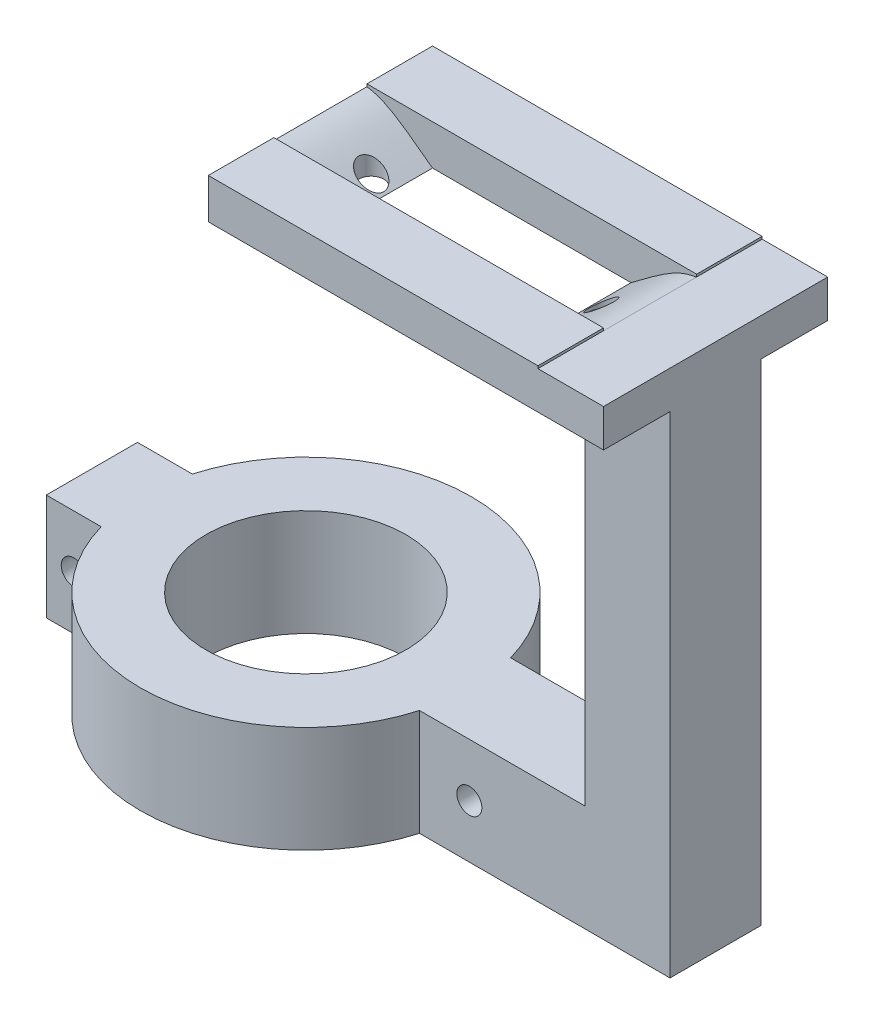
from build123d import *

# Parameters (mm, degrees)
SKETCH_1_W           = 50.28
SKETCH_1_H           = 34.2
SKETCH_1_W_2         = 30.28
SKETCH_1_H_2         = 14.2
EXTRUDE_1_DEPTH      = 12.25
SKETCH_4_W           = 13
SKETCH_4_H           = 13.91
EXTRUDE_1_2_DEPTH    = 74.82
SKETCH_5_W           = 13.91
SKETCH_5_H           = 16.23
EXTRUDE_2_DEPTH      = 16
SKETCH_7_R           = 25.25
SKETCH_7_R_2         = 15.25
EXTRUDE_2_2_DEPTH    = 16.23
SKETCH_15_R          = 1.91
CUT_EXTRUDE_6_DEPTH  = 97.964478439
SKETCH_16_W          = 13.91
SKETCH_16_H          = 16.23
EXTRUDE_4_DEPTH      = 10
SKETCH_17_R          = 1.91
CUT_EXTRUDE_7_DEPTH  = 102.16913771
SKETCH_18_W          = 49.344544624
SKETCH_18_H          = 6.125
CUT_EXTRUDE_8_DEPTH  = 105.840616652
SKETCH_19_W          = 34.2
SKETCH_19_H          = 6.125
CUT_EXTRUDE_9_DEPTH  = 10
SKETCH_21_R          = 1.91
CUT_EXTRUDE_10_DEPTH = 10
SKETCH_20_R          = 1.91
CUT_EXTRUDE_11_DEPTH = 10
FILLET_START         = -7.1
FILLET_1_DEPTH       = 14.2
FILLET_2_DEPTH       = 14.2
SKETCH_29_W          = 13.91
SKETCH_29_H          = 74.82
EXTRUDE_5_DEPTH      = 10
SKETCH_30_W          = 10
SKETCH_30_H          = 58.59
CUT_EXTRUDE_13_DEPTH = 102.16913771
SKETCH_32_W          = 34.2
SKETCH_32_H          = 5.745736365
EXTRUDE_6_DEPTH      = 10


with BuildPart() as part:
    # 草圖1 → Extrude 1 (new body)
    with BuildSketch(Plane(origin=(0, 0, 0), x_dir=(1, 0, 0), z_dir=(0, 1, 0))):
        Rectangle(SKETCH_1_W, SKETCH_1_H)
        Rectangle(SKETCH_1_W_2, SKETCH_1_H_2, mode=Mode.SUBTRACT)
    extrude(amount=EXTRUDE_1_DEPTH)

    # 草圖4 → Extrude 1 2 (add)
    with BuildSketch(Plane.XZ):
        with Locations((18.64, 0)):
            Rectangle(SKETCH_4_W, SKETCH_4_H)
    extrude(amount=EXTRUDE_1_2_DEPTH)

    # 草圖5 → Extrude 2 (add)
    with BuildSketch(Plane.ZY.offset(-12.14)):
        with Locations((0, -66.705)):
            Rectangle(SKETCH_5_W, SKETCH_5_H)
    extrude(amount=EXTRUDE_2_DEPTH)

    # 草圖7 → Extrude 2 2 (add)
    with BuildSketch(Plane(origin=(3.626674765, -74.82, 0), x_dir=(1, 0, 0), z_dir=(0, -1, 0))):
        with Locations((-30.978154344, 0)):
            Circle(SKETCH_7_R)
        with Locations((-30.978154344, 0)):
            Circle(SKETCH_7_R_2, mode=Mode.SUBTRACT)
    extrude(amount=-EXTRUDE_2_2_DEPTH)

    # 草圖15 → 除料-伸長6 (cut, through all)
    with BuildSketch(Plane(origin=(0, 0, -6.955), x_dir=(-1, 0, 0), z_dir=(0, 0, -1))):
        with Locations((-4.530883248, -66.705)):
            Circle(SKETCH_15_R)
    extrude(amount=-CUT_EXTRUDE_6_DEPTH, mode=Mode.SUBTRACT)

    # 草圖16 → 填料-伸長4 (add)
    with BuildSketch(Plane(origin=(-60, 0, 0), x_dir=(0, 0, -1), z_dir=(1, 0, 0))):
        with Locations((0, -66.705)):
            Rectangle(SKETCH_16_W, SKETCH_16_H)
    extrude(amount=EXTRUDE_4_DEPTH)

    # 草圖17 → 除料-伸長7 (cut, through all)
    with BuildSketch(Plane(origin=(0, 0, -6.955), x_dir=(-1, 0, 0), z_dir=(0, 0, -1))):
        with Locations((55.812362827, -66.705)):
            Circle(SKETCH_17_R)
    extrude(amount=-CUT_EXTRUDE_7_DEPTH, mode=Mode.SUBTRACT)

    # 草圖18 → 除料-伸長8 (cut, through all)
    with BuildSketch(Plane(origin=(0, 0, -17.1), x_dir=(-1, 0, 0), z_dir=(0, 0, -1))):
        with Locations((0.467727688, 9.1875)):
            Rectangle(SKETCH_18_W, SKETCH_18_H)
    extrude(amount=-CUT_EXTRUDE_8_DEPTH, mode=Mode.SUBTRACT)

    # 草圖19 → 除料-伸長9 (cut)
    with BuildSketch(Plane.ZY.offset(-24.204544624)):
        with Locations((0, 9.1875)):
            Rectangle(SKETCH_19_W, SKETCH_19_H)
    extrude(amount=-CUT_EXTRUDE_9_DEPTH, mode=Mode.SUBTRACT)

    # 草圖21 → 除料-伸長10 (cut)
    with BuildSketch(Plane(origin=(0, 6.125, 0), x_dir=(1, 0, 0), z_dir=(0, 1, 0))):
        with Locations(Location((17.69, 0, 0), (0, 0, 270))):
            Circle(SKETCH_21_R)
    extrude(amount=-CUT_EXTRUDE_10_DEPTH, mode=Mode.SUBTRACT)

    # 草圖20 → 除料-伸長11 (cut)
    with BuildSketch(Plane(origin=(0, 6.125, 0), x_dir=(1, 0, 0), z_dir=(0, 1, 0))):
        with Locations(Location((-17.395, 0, 0), (0, 0, 270))):
            Circle(SKETCH_20_R)
    extrude(amount=-CUT_EXTRUDE_11_DEPTH, mode=Mode.SUBTRACT)

    # 圓角1: read off the stored shape, not the designer's step
    # 圓角1 outline → 圓角1 (cut)
    with BuildSketch(Plane.XY.offset(FILLET_START)):
        with BuildLine():
            add(Edge.make_bspline(
                [(-15.14, 0), (-21.974170252, 5.199829476), (-25.14, 5.745736365)],
                knots=[0, 0, 0, 0.664102345, 0.664102345, 0.664102345], degree=2, weights=[1, 2.223777218, 1.822127795]))
            Line((-15.14, 0), (-15.14, 6.125))
            Line((-15.14, 6.125), (-25.14, 6.125))
            Line((-25.14, 6.125), (-25.14, 5.745736365))
        make_face()
    extrude(amount=FILLET_1_DEPTH, mode=Mode.SUBTRACT)

    # 圓角2: read off the stored shape, not the designer's step
    # 圓角2 outline → 圓角2 (cut)
    with BuildSketch(Plane.XY.offset(FILLET_START)):
        with BuildLine():
            Line((15.14, 6.125), (15.14, 0))
            add(Edge.make_bspline(
                [(15.14, 0), (21.974170252, 5.199829476), (25.14, 5.745736365)],
                knots=[0, 0, 0, 0.664102345, 0.664102345, 0.664102345], degree=2, weights=[1, 2.223777218, 1.822127795]))
            Line((25.14, 5.745736365), (25.14, 6.125))
            Line((25.14, 6.125), (15.14, 6.125))
        make_face()
    extrude(amount=FILLET_2_DEPTH, mode=Mode.SUBTRACT)

    # 草圖29 → 填料-伸長5 (add)
    with BuildSketch(Plane(origin=(25.14, 0, 0), x_dir=(0, 0, -1), z_dir=(1, 0, 0))):
        with Locations((0, -37.41)):
            Rectangle(SKETCH_29_W, SKETCH_29_H)
    extrude(amount=EXTRUDE_5_DEPTH)

    # 草圖30 → 除料-伸長13 (cut, through all)
    with BuildSketch(Plane.XY.offset(6.955)):
        with Locations((17.14, -29.295)):
            Rectangle(SKETCH_30_W, SKETCH_30_H)
    extrude(amount=-CUT_EXTRUDE_13_DEPTH, mode=Mode.SUBTRACT)

    # 草圖32 → 填料-伸長6 (add)
    with BuildSketch(Plane(origin=(25.14, 0, 0), x_dir=(0, 0, -1), z_dir=(1, 0, 0))):
        with Locations((0, 2.872868182)):
            Rectangle(SKETCH_32_W, SKETCH_32_H)
    extrude(amount=EXTRUDE_6_DEPTH)


solid = part.part
